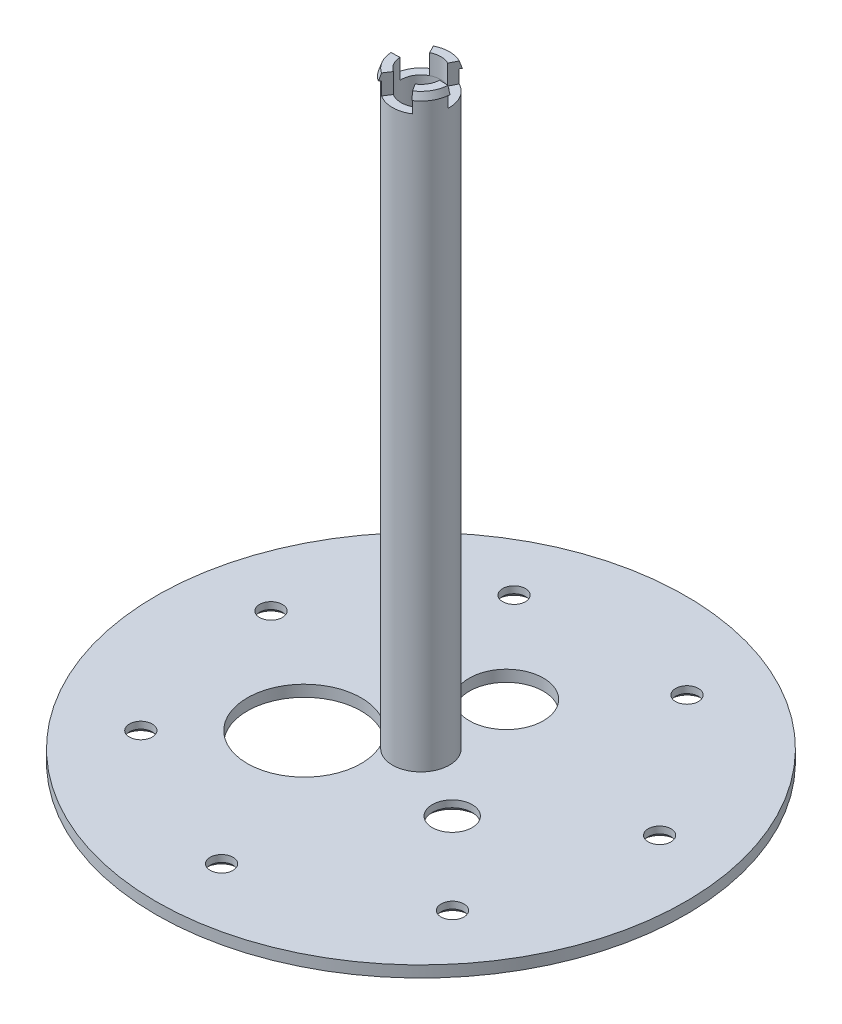
from build123d import *
from build123d.topology import SkipClean

# Parameters (mm, degrees)
SKETCH1_R           = 46.5
SKETCH1_R_2         = 6.5
SKETCH1_R_3         = 10
SKETCH1_R_4         = 3.5
BOSS_EXTRUDE1_DEPTH = 2
SKETCH3_R           = 5
SKETCH3_R_2         = 3.5
BOSS_EXTRUDE2_DEPTH = 100
CUT_EXTRUDE2_REACH  = 123.361
SKETCH6_R           = 2
CHAMFER2_SIZE       = 0.8
REVOLVE1_ANGLE      = 54
CIRPATTERN1_COUNT   = 3


# Read off the part's stored shape, not the designer's step: Revolve1
with BuildPart() as part:
    # Sketch1 → Boss-Extrude1 (new body)
    with BuildSketch(Plane(origin=(0, 0, 0), x_dir=(1, 0, 0), z_dir=(0, 1, 0))):
        with Locations(Location((0, 0, 0), (0, 0, 270))):
            Circle(SKETCH1_R)
        with Locations(Location((0, 15, 0), (0, 0, 270))):
            Circle(SKETCH1_R_2, mode=Mode.SUBTRACT)
        with Locations(Location((-12.990381057, -7.5, 0), (0, 0, 270))):
            Circle(SKETCH1_R_3, mode=Mode.SUBTRACT)
        with Locations(Location((12.990381057, -7.5, 0), (0, 0, 270))):
            Circle(SKETCH1_R_4, mode=Mode.SUBTRACT)
        with Locations(Location((0, 0, 0), (0, 0, 270))):
            Circle(SKETCH1_R_4, mode=Mode.SUBTRACT)
    extrude(amount=BOSS_EXTRUDE1_DEPTH)

    # Sketch3 → Boss-Extrude2 (add)
    with BuildSketch(Plane(origin=(0, 2, 0), x_dir=(1, 0, 0), z_dir=(0, 1, 0))):
        with Locations(Location((0, 0, 0), (0, 0, 210))):
            Circle(SKETCH3_R)
        with Locations(Location((0, 0, 0), (0, 0, 270))):
            Circle(SKETCH3_R_2, mode=Mode.SUBTRACT)
    extrude(amount=BOSS_EXTRUDE2_DEPTH)

    # Sketch6 → Cut-Extrude2 (cut, up to next)
    with BuildSketch(Plane.XZ, mode=Mode.PRIVATE) as cut_extrude2_sk1:
        with Locations(Location((0, 35, 0), (0, 0, 270))):
            Circle(SKETCH6_R)
    cut_extrude2_tool1 = extrude(cut_extrude2_sk1.sketch, amount=-CUT_EXTRUDE2_REACH, mode=Mode.PRIVATE) & part.part
    # Sketch6 → Cut-Extrude2 (cut, up to next)
    with BuildSketch(Plane.XZ, mode=Mode.PRIVATE) as cut_extrude2_sk2:
        with Locations(Location((27.364101886, 21.822143065, 0), (0, 0, 270))):
            Circle(SKETCH6_R)
    cut_extrude2_tool2 = extrude(cut_extrude2_sk2.sketch, amount=-CUT_EXTRUDE2_REACH, mode=Mode.PRIVATE) & part.part
    # Sketch6 → Cut-Extrude2 (cut, up to next)
    with BuildSketch(Plane.XZ, mode=Mode.PRIVATE) as cut_extrude2_sk3:
        with Locations(Location((34.122476926, -7.788232688, 0), (0, 0, 270))):
            Circle(SKETCH6_R)
    cut_extrude2_tool3 = extrude(cut_extrude2_sk3.sketch, amount=-CUT_EXTRUDE2_REACH, mode=Mode.PRIVATE) & part.part
    # Sketch6 → Cut-Extrude2 (cut, up to next)
    with BuildSketch(Plane.XZ, mode=Mode.PRIVATE) as cut_extrude2_sk4:
        with Locations(Location((15.185930869, -31.533910377, 0), (0, 0, 270))):
            Circle(SKETCH6_R)
    cut_extrude2_tool4 = extrude(cut_extrude2_sk4.sketch, amount=-CUT_EXTRUDE2_REACH, mode=Mode.PRIVATE) & part.part
    # Sketch6 → Cut-Extrude2 (cut, up to next)
    with BuildSketch(Plane.XZ, mode=Mode.PRIVATE) as cut_extrude2_sk5:
        with Locations(Location((-15.185930869, -31.533910377, 0), (0, 0, 270))):
            Circle(SKETCH6_R)
    cut_extrude2_tool5 = extrude(cut_extrude2_sk5.sketch, amount=-CUT_EXTRUDE2_REACH, mode=Mode.PRIVATE) & part.part
    # Sketch6 → Cut-Extrude2 (cut, up to next)
    with BuildSketch(Plane.XZ, mode=Mode.PRIVATE) as cut_extrude2_sk6:
        with Locations(Location((-34.122476926, -7.788232688, 0), (0, 0, 270))):
            Circle(SKETCH6_R)
    cut_extrude2_tool6 = extrude(cut_extrude2_sk6.sketch, amount=-CUT_EXTRUDE2_REACH, mode=Mode.PRIVATE) & part.part
    # Sketch6 → Cut-Extrude2 (cut, up to next)
    with BuildSketch(Plane.XZ, mode=Mode.PRIVATE) as cut_extrude2_sk7:
        with Locations(Location((-27.364101886, 21.822143065, 0), (0, 0, 270))):
            Circle(SKETCH6_R)
    cut_extrude2_tool7 = extrude(cut_extrude2_sk7.sketch, amount=-CUT_EXTRUDE2_REACH, mode=Mode.PRIVATE) & part.part
    add(cut_extrude2_tool1.solids().sort_by_distance((0, 0, 35))[0], mode=Mode.SUBTRACT)
    add(cut_extrude2_tool2.solids().sort_by_distance((27.364102, 0, 21.822143))[0], mode=Mode.SUBTRACT)
    add(cut_extrude2_tool3.solids().sort_by_distance((34.122477, 0, -7.788233))[0], mode=Mode.SUBTRACT)
    add(cut_extrude2_tool4.solids().sort_by_distance((15.185931, 0, -31.53391))[0], mode=Mode.SUBTRACT)
    add(cut_extrude2_tool5.solids().sort_by_distance((-15.185931, 0, -31.53391))[0], mode=Mode.SUBTRACT)
    add(cut_extrude2_tool6.solids().sort_by_distance((-34.122477, 0, -7.788233))[0], mode=Mode.SUBTRACT)
    add(cut_extrude2_tool7.solids().sort_by_distance((-27.364102, 0, 21.822143))[0], mode=Mode.SUBTRACT)

    # Chamfer2
    chamfer2_edges = [part.edges().sort_by_distance(p)[0] for p in [
        (12.990381057, 0, 4),
        (34.122476926, 0, -5.788232688),
        (27.364101886, 0, 23.822143065),
        (0, 0, 37),
        (-27.364101886, 0, 23.822143065),
        (-34.122476926, 0, -5.788232688),
        (-15.185930869, 0, -29.533910377),
        (15.185930869, 0, -29.533910377),
    ]]
    chamfer(chamfer2_edges, length=CHAMFER2_SIZE)


with BuildPart() as body_2:
    # Revolve1 outline → Revolve1 (revolve)
    with BuildSketch(Plane(origin=(0, 0, 0), x_dir=(0.4539904997395532, 0, -0.8910065241883646), z_dir=(0.8910065241883646, 0, 0.4539904997395532))):
        Polygon((5, 102), (5, 104.3), (5.4, 104.3), (5, 105.5), (3.5, 105.5), (3.5, 102), align=None)
    revolve1 = revolve(axis=Axis((0, 0, 0), (0, 1, 0)), revolution_arc=REVOLVE1_ANGLE)


with BuildPart() as part_1:
    with SkipClean():  # the faces are left unmerged after this step: merging them gives an invalid solid
        add(part.part)

        # CirPattern1: Revolve1 ×3 about axis
        cirpattern1_axis = Axis((0, 102, 0), (0, -1, 0))
        for i in range(1, CIRPATTERN1_COUNT):
            add(revolve1.rotate(cirpattern1_axis, i * 360 / CIRPATTERN1_COUNT))


solid = Compound([body_2.part, part_1.part])
